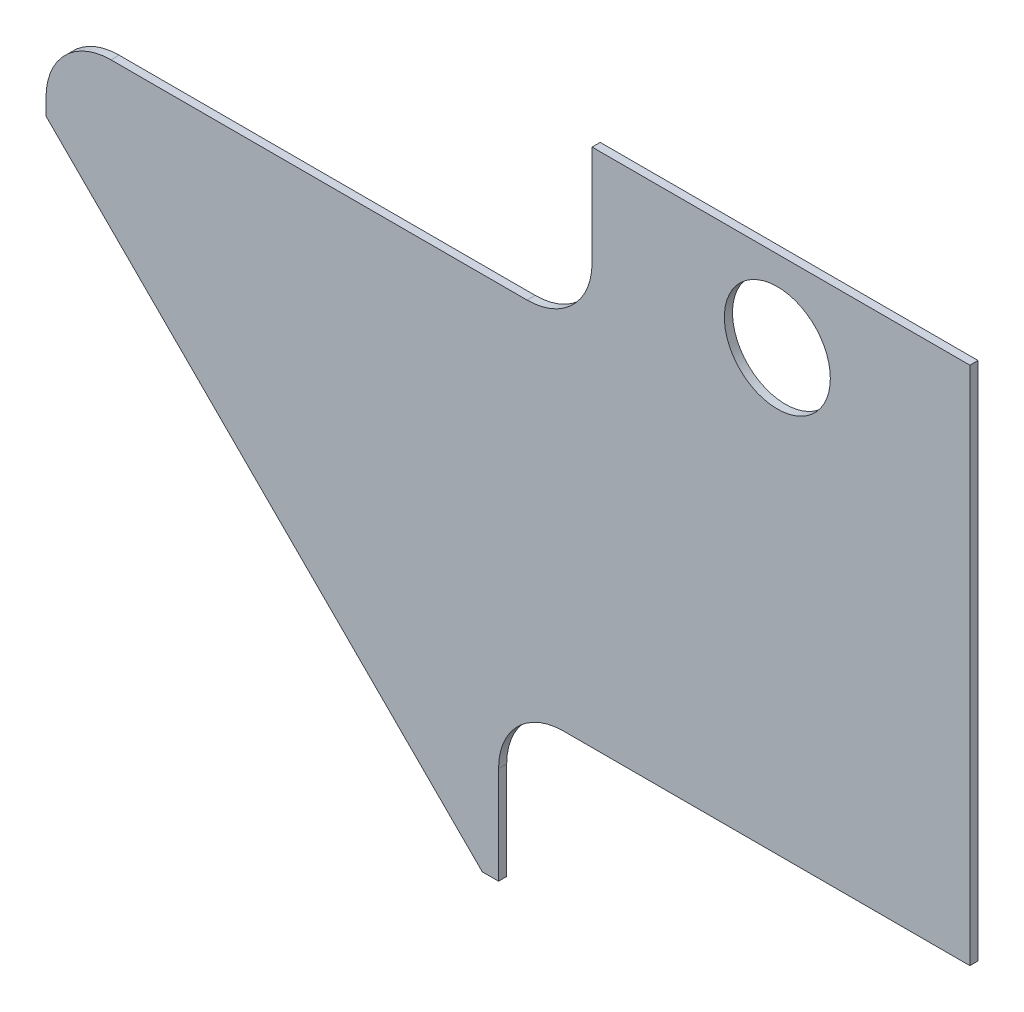
from build123d import *

# Parameters (mm, degrees)
SKETCH1_R           = 20.701
BOSS_EXTRUDE1_DEPTH = 3.175
SKETCH2_W           = 184.15
SKETCH2_H           = 63.5
SKETCH2_W_2         = 213.36
SKETCH2_H_2         = 64.479988722
CUT_EXTRUDE1_DEPTH  = 266.893552722
FILLET1_R           = 25.4
FILLET2_R           = 25.4


with BuildPart() as part:
    # Sketch1 → Boss-Extrude1 (new body)
    with BuildSketch(Plane.XY):
        Polygon((-138.259383474, 48.991487021), (32.210627804, -121.478524257), (222.710627804, -121.478524257), (222.710627804, 145.221475743), (-138.259383474, 145.221475743), align=None)
        with Locations((147.490616526, 113.471475743)):
            Circle(SKETCH1_R, mode=Mode.SUBTRACT)
    extrude(amount=BOSS_EXTRUDE1_DEPTH)

    # Sketch2 → Cut-Extrude1 (cut, through all)
    with BuildSketch(Plane.XY.offset(3.175)):
        with Locations((130.635627804, -89.728524257)):
            Rectangle(SKETCH2_W, SKETCH2_H)
        with Locations((-31.579383474, 112.981481382)):
            Rectangle(SKETCH2_W_2, SKETCH2_H_2)
    extrude(amount=-CUT_EXTRUDE1_DEPTH, mode=Mode.SUBTRACT)

    # Fillet1
    fillet1_edges = [part.edges().sort_by_distance(p)[0] for p in [
        (75.100616526, 80.741487021, 1.5875),
    ]]
    fillet(fillet1_edges, radius=FILLET1_R)

    # Fillet2
    fillet2_edges = [part.edges().sort_by_distance(p)[0] for p in [
        (38.560627804, -57.978524257, 1.5875),
        (-138.259383474, 80.741487021, 1.5875),
    ]]
    fillet(fillet2_edges, radius=FILLET2_R)


solid = part.part
